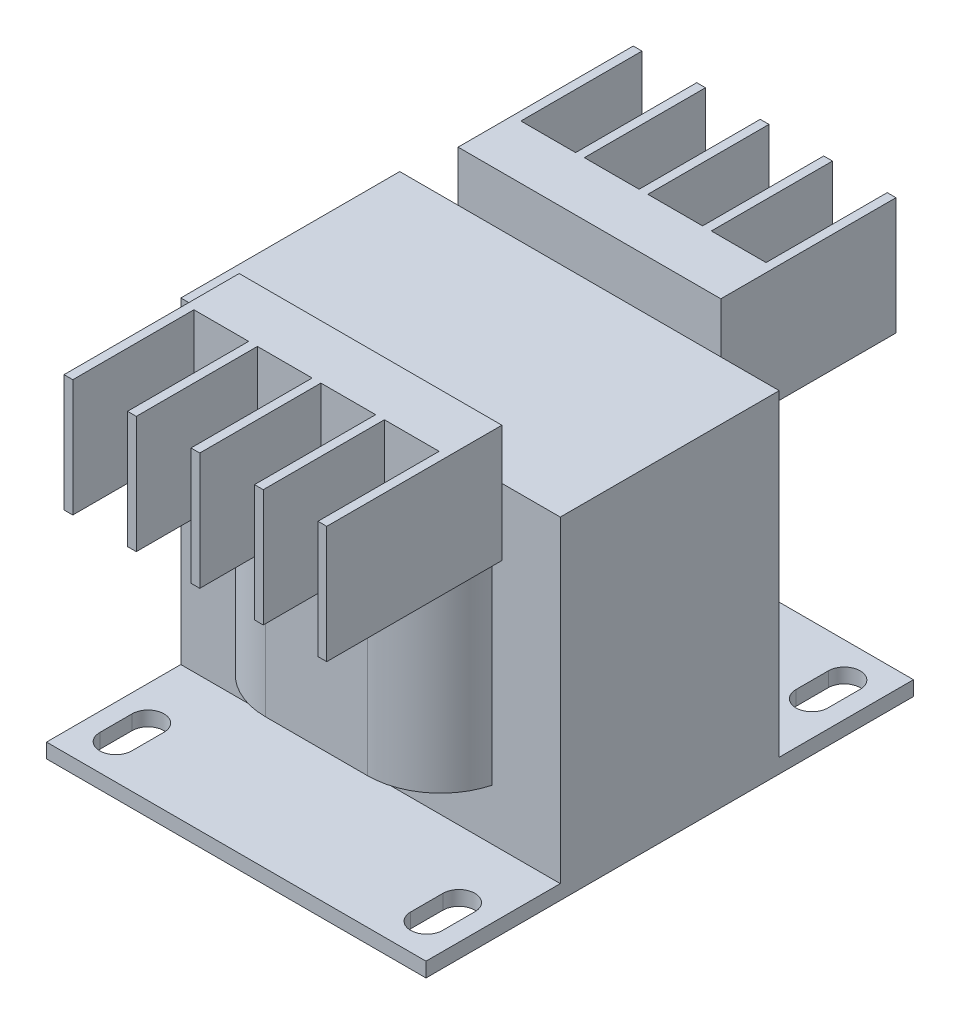
from build123d import *

# Parameters (mm, degrees)
SKETCH1_W                           = 66.04
SKETCH1_H                           = 84.836
BOSS_EXTRUDE1_DEPTH                 = 2.54
F_7_32_0_21875_DIAMETER_SLOT1_DEPTH = 2.54
SKETCH4_W                           = 66.04
SKETCH4_H                           = 38.1
BOSS_EXTRUDE2_DEPTH                 = 55.245
BOSS_EXTRUDE3_DEPTH                 = 34.7218
BOSS_EXTRUDE4_DEPTH                 = 20.3962


# Read off the part's stored shape, not the designer's step: 7/32 (0.21875) Diameter Slot1
with BuildPart() as part:
    # Sketch1 → Boss-Extrude1 (new body)
    with BuildSketch(Plane(origin=(0, 0, 0), x_dir=(1, 0, 0), z_dir=(0, 1, 0))):
        Rectangle(SKETCH1_W, SKETCH1_H)
    extrude(amount=BOSS_EXTRUDE1_DEPTH)

    # 7/32 (0.21875) Diameter Slot1 outline → 7/32 (0.21875) Diameter Slot1 (cut)
    with BuildSketch(Plane(origin=(0, 0, 0), x_dir=(1, 0, 0), z_dir=(0, 1, 0))):
        with BuildLine():
            Line((-24.272875, -36.337875), (-24.272875, -30.718125))
            ThreePointArc((-24.272875, -30.718125), (-27.051, -27.94), (-29.829125, -30.718125))
            Line((-29.829125, -30.718125), (-29.829125, -36.337875))
            ThreePointArc((-29.829125, -36.337875), (-27.051, -39.116), (-24.272875, -36.337875))
        make_face()
        with BuildLine():
            ThreePointArc((-24.272875, 36.337875), (-27.051, 39.116), (-29.829125, 36.337875))
            Line((-29.829125, 36.337875), (-29.829125, 30.718125))
            ThreePointArc((-29.829125, 30.718125), (-27.051, 27.94), (-24.272875, 30.718125))
            Line((-24.272875, 30.718125), (-24.272875, 36.337875))
        make_face()
        with BuildLine():
            Line((29.829125, -36.337875), (29.829125, -30.718125))
            ThreePointArc((29.829125, -30.718125), (27.051, -27.94), (24.272875, -30.718125))
            Line((24.272875, -30.718125), (24.272875, -36.337875))
            ThreePointArc((24.272875, -36.337875), (27.051, -39.116), (29.829125, -36.337875))
        make_face()
        with BuildLine():
            ThreePointArc((29.829125, 36.337875), (27.051, 39.116), (24.272875, 36.337875))
            Line((24.272875, 36.337875), (24.272875, 30.718125))
            ThreePointArc((24.272875, 30.718125), (27.051, 27.94), (29.829125, 30.718125))
            Line((29.829125, 30.718125), (29.829125, 36.337875))
        make_face()
    extrude(amount=F_7_32_0_21875_DIAMETER_SLOT1_DEPTH, mode=Mode.SUBTRACT)

    # Sketch4 → Boss-Extrude2 (add)
    with BuildSketch(Plane(origin=(0, 2.54, 0), x_dir=(1, 0, 0), z_dir=(0, 1, 0))):
        Rectangle(SKETCH4_W, SKETCH4_H)
    extrude(amount=BOSS_EXTRUDE2_DEPTH)

    # Sketch5 → Boss-Extrude3 (add)
    with BuildSketch(Plane(origin=(0, 11.43, 0), x_dir=(1, 0, 0), z_dir=(0, 1, 0))):
        with BuildLine():
            Line((-21.59, 15.748), (-21.59, -15.748))
            ThreePointArc((-21.59, -15.748), (-17.870256121, -24.728256121), (-8.89, -28.448))
            Line((-8.89, -28.448), (8.89, -28.448))
            ThreePointArc((8.89, -28.448), (17.870256121, -24.728256121), (21.59, -15.748))
            Line((21.59, -15.748), (21.59, 15.748))
            ThreePointArc((21.59, 15.748), (17.870256121, 24.728256121), (8.89, 28.448))
            Line((8.89, 28.448), (-8.89, 28.448))
            ThreePointArc((-8.89, 28.448), (-17.870256121, 24.728256121), (-21.59, 15.748))
        make_face()
    extrude(amount=BOSS_EXTRUDE3_DEPTH)

    # Sketch6 → Boss-Extrude4 (add)
    with BuildSketch(Plane(origin=(0, 46.1518, 0), x_dir=(1, 0, 0), z_dir=(0, 1, 0))):
        Polygon((22.86, -19.05), (-22.86, -19.05), (-22.86, -49.53), (-21.336, -49.53), (-21.336, -28.448), (-11.811, -28.448), (-11.811, -49.53), (-10.287, -49.53), (-10.287, -28.448), (-0.762, -28.448), (-0.762, -49.53), (0.762, -49.53), (0.762, -28.448), (10.287, -28.448), (10.287, -49.53), (11.811, -49.53), (11.811, -28.448), (21.336, -28.448), (21.336, -49.53), (22.86, -49.53), align=None)
    boss_extrude4 = extrude(amount=BOSS_EXTRUDE4_DEPTH)

    # Mirror1: Boss-Extrude4 across plane
    add(boss_extrude4.mirror(Plane.XY))


solid = part.part
